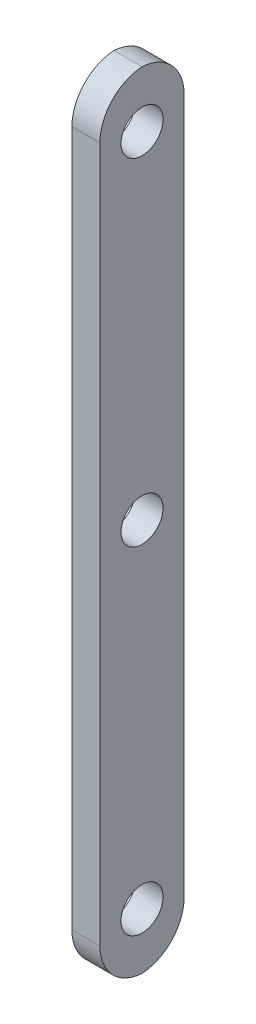
from build123d import *

# Parameters (mm, degrees)
SKETCH1_W           = 15
SKETCH1_H           = 140
SKETCH1_R           = 3.75
BOSS_EXTRUDE1_DEPTH = 5
FILLET1_R           = 8


with BuildPart() as part:
    # Sketch1 → Boss-Extrude1 (new body)
    with BuildSketch(Plane(origin=(0, 0, 0), x_dir=(0, 0, -1), z_dir=(1, 0, 0))):
        Rectangle(SKETCH1_W, SKETCH1_H)
        Circle(SKETCH1_R, mode=Mode.SUBTRACT)
        with Locations((0, 60)):
            Circle(SKETCH1_R, mode=Mode.SUBTRACT)
        with Locations((0, -60)):
            Circle(SKETCH1_R, mode=Mode.SUBTRACT)
    extrude(amount=BOSS_EXTRUDE1_DEPTH)

    # Fillet1
    # the kernel refuses this fillet: 8 mm, written as the material it takes off along each edge
    with BuildSketch(Plane(origin=(-20, -70, 7.5), x_dir=(0, 0, -1), z_dir=(1, 0, 0))) as fillet1_piece_1:
        with BuildLine():
            CenterArc((FILLET1_R, FILLET1_R), FILLET1_R, 180, 90)
            Line((0, FILLET1_R), (0, 0))
            Line((0, 0), (FILLET1_R, 0))
        make_face()
    extrude(amount=45, mode=Mode.SUBTRACT)
    with BuildSketch(Plane(origin=(-20, -70, -7.5), x_dir=(0, 0, 1), z_dir=(1, 0, 0)), Plane(origin=(-20, 70, -7.5), x_dir=(0, -1, 0), z_dir=(1, 0, 0)), Plane(origin=(-20, 70, 7.5), x_dir=(0, 0, -1), z_dir=(1, 0, 0))) as fillet1_piece_2:
        with BuildLine():
            CenterArc((FILLET1_R, -FILLET1_R), FILLET1_R, 90, 90)
            Line((0, -FILLET1_R), (0, 0))
            Line((0, 0), (FILLET1_R, 0))
        make_face()
    extrude(amount=45, mode=Mode.SUBTRACT)


solid = part.part
